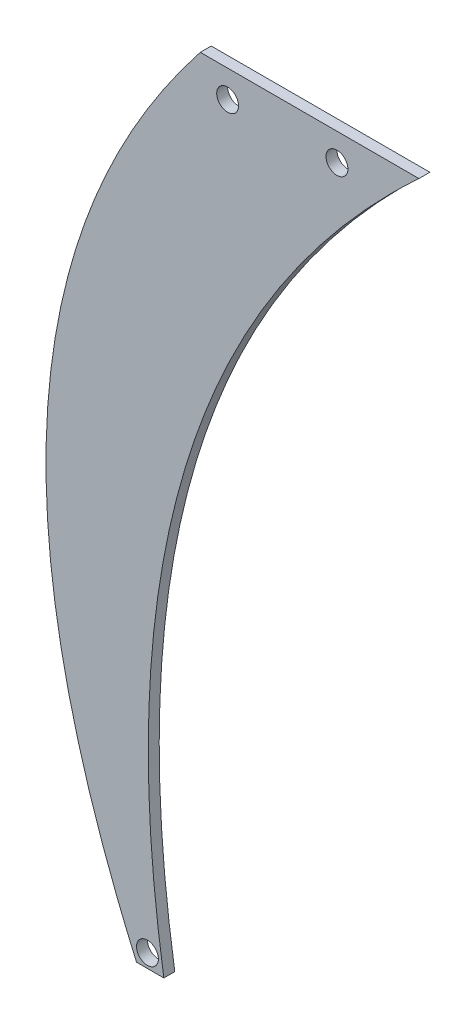
from build123d import *

# Parameters (mm, degrees)
EXTRUDE_1_DEPTH     = 2
SKETCH_2_R          = 2
CUT_EXTRUDE_1_DEPTH = 156.254629684


with BuildPart() as part:
    # Эскиз1 → Бобышка-Вытянуть1 (new body)
    with BuildSketch(Plane.XY):
        with BuildLine():
            Line((0, 0), (40, 0))
            add(Edge.make_bspline(
                [(40, 0), (-21.389317784, -56.818064534), (-6.67027027, -150)],
                knots=[0, 0, 0, 1, 1, 1], degree=2))
            Line((-6.67027027, -150), (-11.67027027, -150))
            add(Edge.make_bspline(
                [(0, 0), (-49.854113681, -63.235965622), (-11.67027027, -150)],
                knots=[0, 0, 0, 1, 1, 1], degree=2))
        make_face()
    extrude(amount=EXTRUDE_1_DEPTH)

    # Эскиз2 → Вырез-Вытянуть1 (cut, through all)
    with BuildSketch(Plane.XY.offset(2)):
        with Locations((5, -5)):
            Circle(SKETCH_2_R)
        with Locations((25, -5)):
            Circle(SKETCH_2_R)
        with Locations((-9.67027027, -147.5)):
            Circle(SKETCH_2_R)
    extrude(amount=-CUT_EXTRUDE_1_DEPTH, mode=Mode.SUBTRACT)


solid = part.part
